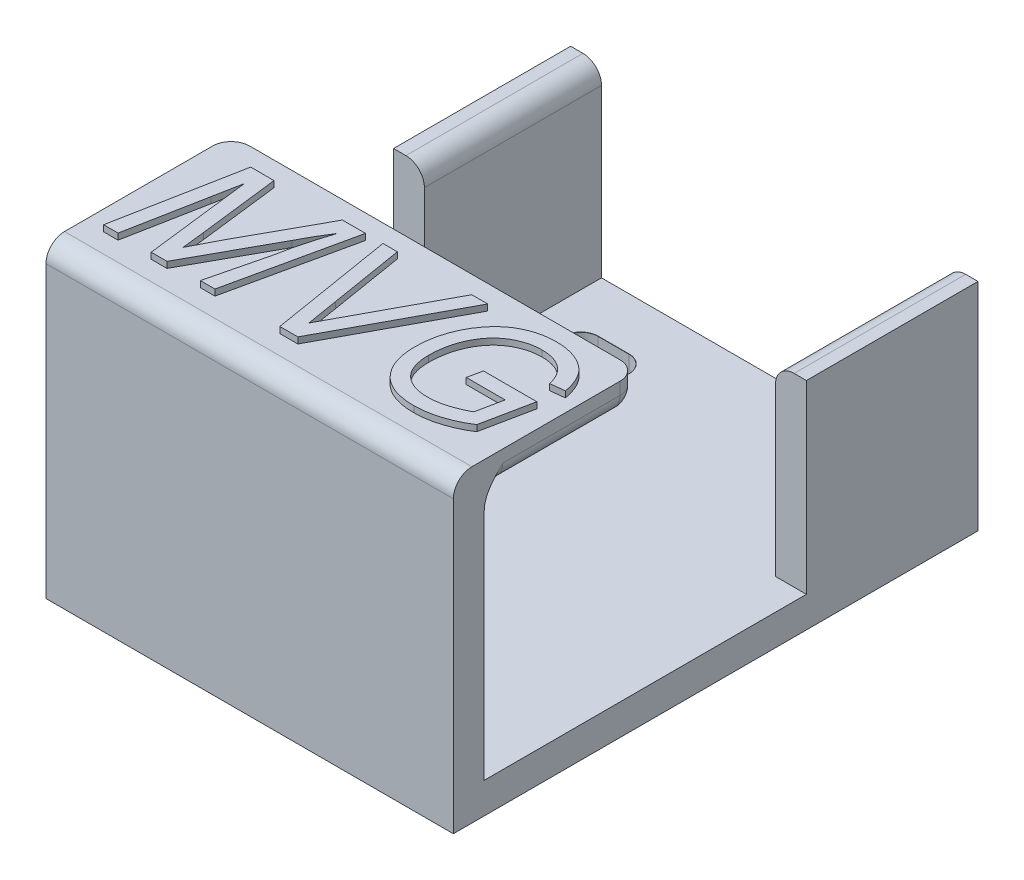
from build123d import *

# Parameters (mm, degrees)
SKETCH_1_W            = 66
SKETCH_1_H            = 85
EXTRUDE_297_DEPTH     = 5
SKETCH_2_W            = 66
SKETCH_2_H            = 5
EXTRUDE_2_DEPTH       = 45
SKETCH_3_W            = 66
SKETCH_3_H            = 5
EXTRUDE_3_DEPTH       = 25
SKETCH_4_W            = 5
SKETCH_4_H            = 28.694306297
SKETCH_4_H_2          = 27.803616381
EXTRUDE_4_DEPTH       = 30
HOLE_START            = -1
HOLE_WIZARD_M51_DEPTH = 7
FILLET_1_R            = 3
FILLET_2_R            = 3
FILLET_6_R            = 3
FILLET_9_R            = 3
FILLET_10_R           = 3
FILLET_11_R           = 3
FILLET_12_R           = 3
EXTRUDE_2578_DEPTH    = 1


with BuildPart() as part:
    # Эскиз1 → Extrude 297 (new body)
    with BuildSketch(Plane(origin=(0, 0, 0), x_dir=(1, 0, 0), z_dir=(0, 1, 0))):
        with Locations((33, 42.5)):
            Rectangle(SKETCH_1_W, SKETCH_1_H)
    extrude(amount=EXTRUDE_297_DEPTH)

    # Эскиз2 → Бобышка-Вытянуть2 (add)
    with BuildSketch(Plane(origin=(0, 5, 0), x_dir=(1, 0, 0), z_dir=(0, 1, 0))):
        with Locations((33, 2.5)):
            Rectangle(SKETCH_2_W, SKETCH_2_H)
    extrude(amount=EXTRUDE_2_DEPTH)

    # Эскиз3 → Бобышка-Вытянуть3 (add)
    with BuildSketch(Plane(origin=(0, 0, -5), x_dir=(-1, 0, 0), z_dir=(0, 0, -1))):
        with Locations((-33, 47.5)):
            Rectangle(SKETCH_3_W, SKETCH_3_H)
    extrude(amount=EXTRUDE_3_DEPTH)

    # Эскиз4 → Бобышка-Вытянуть4 (add)
    with BuildSketch(Plane(origin=(0, 5, 0), x_dir=(1, 0, 0), z_dir=(0, 1, 0))):
        with Locations((2.5, 70.652846852)):
            Rectangle(SKETCH_4_W, SKETCH_4_H)
        with Locations((63.5, 71.09819181)):
            Rectangle(SKETCH_4_W, SKETCH_4_H_2)
    extrude(amount=EXTRUDE_4_DEPTH)

    # Прорезь с зазором M51: read off the stored shape, not the designer's step
    # Прорезь с зазором M51 outline → Прорезь с зазором M51 (cut)
    with BuildSketch(Plane(origin=(0, 0, 0), x_dir=(1, 0, 0), z_dir=(0, 1, 0)).offset(HOLE_START)):
        with BuildLine():
            Line((49.872505679, 71.03548331), (54.872505679, 71.03548331))
            ThreePointArc((54.872505679, 71.03548331), (57.622505679, 73.78548331), (54.872505679, 76.53548331))
            Line((54.872505679, 76.53548331), (49.872505679, 76.53548331))
            ThreePointArc((49.872505679, 76.53548331), (47.122505679, 73.78548331), (49.872505679, 71.03548331))
        make_face()
        with BuildLine():
            ThreePointArc((17.908874153, 71.03548331), (20.658874153, 73.78548331), (17.908874153, 76.53548331))
            Line((17.908874153, 76.53548331), (12.908874153, 76.53548331))
            ThreePointArc((12.908874153, 76.53548331), (10.158874153, 73.78548331), (12.908874153, 71.03548331))
            Line((12.908874153, 71.03548331), (17.908874153, 71.03548331))
        make_face()
    extrude(amount=HOLE_WIZARD_M51_DEPTH, mode=Mode.SUBTRACT)

    # Hole Wizard M51 2: loft between two sections, ruled curve by curve
    hole_wizard_m51_2_from = [
        Edge.make_three_point_arc((54.872505679, 4.975, -71.03548331), (56.817049328, 4.975, -71.840939662), (57.622505679, 4.975, -73.78548331)),
        Edge.make_three_point_arc((57.622505679, 4.975, -73.78548331), (56.817049328, 4.975, -75.730026958), (54.872505679, 4.975, -76.53548331)),
        Edge.make_three_point_arc((49.872505679, 4.975, -76.53548331), (47.927962031, 4.975, -75.730026958), (47.122505679, 4.975, -73.78548331)),
        Edge.make_three_point_arc((47.122505679, 4.975, -73.78548331), (47.927962031, 4.975, -71.840939662), (49.872505679, 4.975, -71.03548331)),
        Edge.make_line((54.872505679, 4.975, -76.53548331), (49.872505679, 4.975, -76.53548331)),
        Edge.make_line((54.872505679, 4.975, -71.03548331), (49.872505679, 4.975, -71.03548331)),
    ]
    hole_wizard_m51_2_to = [
        Edge.make_three_point_arc((54.872505679, 5, -71.01048331), (56.834726997, 5, -71.823261992), (57.647505679, 5, -73.78548331)),
        Edge.make_three_point_arc((57.647505679, 5, -73.78548331), (56.834726997, 5, -75.747704628), (54.872505679, 5, -76.56048331)),
        Edge.make_three_point_arc((49.872505679, 5, -76.56048331), (47.910284362, 5, -75.747704628), (47.097505679, 5, -73.78548331)),
        Edge.make_three_point_arc((47.097505679, 5, -73.78548331), (47.910284362, 5, -71.823261992), (49.872505679, 5, -71.01048331)),
        Edge.make_line((54.872505679, 5, -76.56048331), (49.872505679, 5, -76.56048331)),
        Edge.make_line((54.872505679, 5, -71.01048331), (49.872505679, 5, -71.01048331)),
    ]
    hole_wizard_m51_2 = Solid(Shell([*[Face.make_surface_from_curves(hole_wizard_m51_2_from[k], hole_wizard_m51_2_to[k]) for k in range(6)], Face(Wire(hole_wizard_m51_2_from)), Face(Wire(hole_wizard_m51_2_to))]))
    add(hole_wizard_m51_2, mode=Mode.SUBTRACT)

    # Hole Wizard M51 3: loft between two sections, ruled curve by curve
    hole_wizard_m51_3_from = [
        Edge.make_three_point_arc((17.908874153, 4.975, -71.03548331), (19.853417801, 4.975, -71.840939662), (20.658874153, 4.975, -73.78548331)),
        Edge.make_three_point_arc((20.658874153, 4.975, -73.78548331), (19.853417801, 4.975, -75.730026958), (17.908874153, 4.975, -76.53548331)),
        Edge.make_three_point_arc((12.908874153, 4.975, -76.53548331), (10.964330505, 4.975, -75.730026958), (10.158874153, 4.975, -73.78548331)),
        Edge.make_three_point_arc((10.158874153, 4.975, -73.78548331), (10.964330505, 4.975, -71.840939662), (12.908874153, 4.975, -71.03548331)),
        Edge.make_line((17.908874153, 4.975, -76.53548331), (12.908874153, 4.975, -76.53548331)),
        Edge.make_line((17.908874153, 4.975, -71.03548331), (12.908874153, 4.975, -71.03548331)),
    ]
    hole_wizard_m51_3_to = [
        Edge.make_three_point_arc((17.908874153, 5, -71.01048331), (19.871095471, 5, -71.823261992), (20.683874153, 5, -73.78548331)),
        Edge.make_three_point_arc((20.683874153, 5, -73.78548331), (19.871095471, 5, -75.747704628), (17.908874153, 5, -76.56048331)),
        Edge.make_three_point_arc((12.908874153, 5, -76.56048331), (10.946652835, 5, -75.747704628), (10.133874153, 5, -73.78548331)),
        Edge.make_three_point_arc((10.133874153, 5, -73.78548331), (10.946652835, 5, -71.823261992), (12.908874153, 5, -71.01048331)),
        Edge.make_line((17.908874153, 5, -76.56048331), (12.908874153, 5, -76.56048331)),
        Edge.make_line((17.908874153, 5, -71.01048331), (12.908874153, 5, -71.01048331)),
    ]
    hole_wizard_m51_3 = Solid(Shell([*[Face.make_surface_from_curves(hole_wizard_m51_3_from[k], hole_wizard_m51_3_to[k]) for k in range(6)], Face(Wire(hole_wizard_m51_3_from)), Face(Wire(hole_wizard_m51_3_to))]))
    add(hole_wizard_m51_3, mode=Mode.SUBTRACT)

    # Скругление1
    fillet_1_edges = [part.edges().sort_by_distance(p)[0] for p in [
        (33, 45, -30),
    ]]
    fillet(fillet_1_edges, radius=FILLET_1_R)

    # Скругление2
    fillet_2_edges = [part.edges().sort_by_distance(p)[0] for p in [
        (5, 35, -70.652846851),
    ]]
    fillet(fillet_2_edges, radius=FILLET_2_R)

    # Скругление6
    fillet_6_edges = [part.edges().sort_by_distance(p)[0] for p in [
        (61, 35, -71.098191809),
    ]]
    fillet(fillet_6_edges, radius=FILLET_6_R)

    # Скругление9
    fillet_9_edges = [part.edges().sort_by_distance(p)[0] for p in [
        (0, 49, -30),
        (0, 45, -16),
        (0, 45.878679656, -29.121320344),
    ]]
    fillet(fillet_9_edges, radius=FILLET_9_R)

    # Скругление10
    fillet_10_edges = [part.edges().sort_by_distance(p)[0] for p in [
        (66, 45, -16),
        (66, 45.878679656, -29.121320344),
        (66, 49, -30),
    ]]
    fillet(fillet_10_edges, radius=FILLET_10_R)

    # Скругление11
    fillet_11_edges = [part.edges().sort_by_distance(p)[0] for p in [
        (33, 50, 0),
    ]]
    fillet(fillet_11_edges, radius=FILLET_11_R)

    # Скругление12
    # the kernel refuses this fillet: 3 mm, written as the material it adds along each edge
    with BuildSketch(Plane(origin=(3, 48, -5), x_dir=(0.8017442392976515, 0.5976672776328231, 0), z_dir=(0.5976672776328231, -0.8017442392976515, 0))) as fillet_12_piece_1_section:
        with BuildLine():
            CenterArc((3 + FILLET_12_R, -FILLET_12_R), FILLET_12_R, 90, 90)
            Line((3, -FILLET_12_R), (3, 0))
            Line((3, 0), (3 + FILLET_12_R, 0))
        make_face()
    fillet_12_piece_1 = revolve(axis=Axis((3, 48, -5), (0, 0, 1)), revolution_arc=233.296989237, mode=Mode.PRIVATE)
    fillet_12_piece_1 = split(fillet_12_piece_1, bisect_by=Plane(origin=(3, 50, -5), z_dir=(0, -1, 0)), keep=Keep.TOP, mode=Mode.PRIVATE)
    fillet_12_piece_1 = split(fillet_12_piece_1, bisect_by=Plane(origin=(0, 48, -5), z_dir=(1, 0, 0)), keep=Keep.TOP, mode=Mode.PRIVATE)
    add(fillet_12_piece_1)
    with BuildSketch(Plane(origin=(3, 45, -5), x_dir=(0, -1, 0), z_dir=(1, 0, 0))) as fillet_12_piece_2:
        with BuildLine():
            CenterArc((FILLET_12_R, FILLET_12_R), FILLET_12_R, 180, 90)
            Line((0, FILLET_12_R), (0, 0))
            Line((0, 0), (FILLET_12_R, 0))
        make_face()
    extrude(amount=60)
    with BuildSketch(Plane(origin=(63, 48, -5), x_dir=(-0.8017442392976499, 0.5976672776328252, 0), z_dir=(-0.5976672776328252, -0.8017442392976499, 0))) as fillet_12_piece_3_section:
        with BuildLine():
            CenterArc((3 + FILLET_12_R, FILLET_12_R), FILLET_12_R, 180, 90)
            Line((3 + FILLET_12_R, 0), (3, 0))
            Line((3, 0), (3, FILLET_12_R))
        make_face()
    fillet_12_piece_3 = revolve(axis=Axis((63, 48, -5), (0, 0, -1)), revolution_arc=233.296989237, mode=Mode.PRIVATE)
    fillet_12_piece_3 = split(fillet_12_piece_3, bisect_by=Plane(origin=(63, 50, -5), z_dir=(0, -1, 0)), keep=Keep.TOP, mode=Mode.PRIVATE)
    fillet_12_piece_3 = split(fillet_12_piece_3, bisect_by=Plane(origin=(66, 48, -5), z_dir=(-1, 0, 0)), keep=Keep.TOP, mode=Mode.PRIVATE)
    add(fillet_12_piece_3)

    # Эскиз9 → Extrude 2578 (add)
    with BuildSketch(Plane(origin=(0, 50, 0), x_dir=(1, 0, 0), z_dir=(0, 1, 0))):
        with BuildLine():
            Line((3.210191627, 6.123493175), (7.040319832, 26.123493175))
            Line((7.040319832, 26.123493175), (10.818364704, 26.123493175))
            Line((10.818364704, 26.123493175), (12.396890345, 13.142723944))
            add(Edge.make_bspline(
                [(12.396890345, 13.142723944), (12.422362068, 12.919711675), (12.471163265, 12.492443146), (12.539607466, 11.879495223), (12.598761191, 11.322356769), (12.654274019, 10.822815868), (12.70749324, 10.381062786), (12.752028253, 9.996495563), (12.786416452, 9.668964071), (12.810661259, 9.470155523), (12.821569832, 9.380704713)],
                knots=[0, 0, 0, 0, 1.422923083, 2.72617402, 3.909763634, 4.97461542, 5.912343199, 6.730385719, 7.428756826, 8, 8, 8, 8], degree=3))
            add(Edge.make_bspline(
                [(12.821569832, 9.380704713), (12.861788457, 9.45540912), (12.959208018, 9.636361864), (13.124931848, 9.955551346), (13.343652092, 10.365621262), (13.608141319, 10.869717975), (13.913597971, 11.470267767), (14.272854231, 12.160655513), (14.676530691, 12.944393012), (14.959837585, 13.499202176), (15.109230088, 13.791762405)],
                knots=[0, 0, 0, 0, 0.409776244, 0.992580477, 1.737009525, 2.654476852, 3.742033759, 4.991187186, 6.413402259, 8, 8, 8, 8], degree=3))
            Line((15.109230088, 13.791762405), (21.900095473, 26.123493175))
            Line((21.900095473, 26.123493175), (25.634069832, 26.123493175))
            Line((25.634069832, 26.123493175), (21.251057011, 6.123493175))
            Line((21.251057011, 6.123493175), (18.88326855, 6.123493175))
            Line((18.88326855, 6.123493175), (21.23102496, 15.686794457))
            add(Edge.make_bspline(
                [(21.23102496, 15.686794457), (21.281574613, 15.975545053), (21.385511701, 16.56925627), (21.575419188, 17.477392628), (21.796873787, 18.429546835), (22.049842892, 19.424155841), (22.329393528, 20.462586436), (22.64412663, 21.542501929), (22.987602065, 22.665669267), (23.233230635, 23.427494532), (23.358428806, 23.815800867)],
                knots=[0, 0, 0, 0, 0.836484954, 1.719928915, 2.647136768, 3.625976296, 4.64843834, 5.715822837, 6.835742914, 8, 8, 8, 8], degree=3))
            add(Edge.make_bspline(
                [(23.358428806, 23.815800867), (23.105153522, 23.423220757), (22.607014454, 22.651098476), (21.908810804, 21.486493461), (21.26660216, 20.339134912), (20.874734766, 19.570270986), (20.682146755, 19.192403431)],
                knots=[0, 0, 0, 0, 1.048797977, 2.062764432, 3.047921947, 4, 4, 4, 4], degree=3))
            Line((20.682146755, 19.192403431), (13.482627524, 6.123493175))
            Line((13.482627524, 6.123493175), (10.926537781, 6.123493175))
            Line((10.926537781, 6.123493175), (9.372050601, 18.887916251))
            add(Edge.make_bspline(
                [(9.372050601, 18.887916251), (9.334520648, 19.199064449), (9.254957624, 19.858694664), (9.131607871, 20.905964196), (8.991298437, 22.066480547), (8.891435048, 22.878319713), (8.839198037, 23.302980354)],
                knots=[0, 0, 0, 0, 0.845682193, 1.792835479, 2.845466023, 4, 4, 4, 4], degree=3))
            add(Edge.make_bspline(
                [(8.839198037, 23.302980354), (8.792604309, 23.059896649), (8.702227471, 22.588392482), (8.568502769, 21.903838195), (8.450239951, 21.264865701), (8.337834288, 20.671694201), (8.229371137, 20.127401255), (8.131661137, 19.628223209), (8.049989325, 19.174522357), (7.992907926, 18.887840394), (7.965800601, 18.751698303)],
                knots=[0, 0, 0, 0, 1.281779497, 2.486239759, 3.612086327, 4.647019747, 5.612739922, 6.486241797, 7.281132981, 8, 8, 8, 8], degree=3))
            Line((7.965800601, 18.751698303), (5.549935217, 6.123493175))
            Line((5.549935217, 6.123493175), (3.210191627, 6.123493175))
        make_face()
        with BuildLine():
            Line((31.759871114, 6.123493175), (28.470608293, 26.123493175))
            Line((28.470608293, 26.123493175), (30.806345473, 26.123493175))
            Line((30.806345473, 26.123493175), (32.777499319, 14.124294457))
            add(Edge.make_bspline(
                [(32.777499319, 14.124294457), (32.81999756, 13.861167967), (32.9028583, 13.34813836), (33.02763968, 12.600590466), (33.144449112, 11.894228379), (33.25122474, 11.228715011), (33.356575904, 10.604130895), (33.4529385, 10.019227053), (33.539424666, 9.475199506), (33.598534312, 9.126919431), (33.626858293, 8.960031636)],
                knots=[0, 0, 0, 0, 1.222255508, 2.383086792, 3.475457659, 4.505413456, 5.473947086, 6.380061867, 7.223762935, 8, 8, 8, 8], degree=3))
            add(Edge.make_bspline(
                [(33.626858293, 8.960031636), (33.73495292, 9.161729768), (33.945502324, 9.554602412), (34.254170468, 10.127426143), (34.546053158, 10.668608285), (34.824589138, 11.176909698), (35.079142149, 11.658060265), (35.319722322, 12.106674232), (35.545069045, 12.524145703), (35.688895422, 12.792792463), (35.75826855, 12.92237138)],
                knots=[0, 0, 0, 0, 1.220672504, 2.3776563, 3.470954619, 4.500571287, 5.4693961, 6.374528101, 7.215970862, 8, 8, 8, 8], degree=3))
            Line((35.75826855, 12.92237138), (42.857627524, 26.123493175))
            Line((42.857627524, 26.123493175), (45.437755729, 26.123493175))
            Line((45.437755729, 26.123493175), (34.684550601, 6.123493175))
            Line((34.684550601, 6.123493175), (31.759871114, 6.123493175))
        make_face()
        with BuildLine():
            Line((54.007467268, 14.072211123), (54.496249319, 16.379903431))
            Line((54.496249319, 16.379903431), (63.142082652, 16.379903431))
            Line((63.142082652, 16.379903431), (61.487435217, 8.306986764))
            add(Edge.make_bspline(
                [(61.487435217, 8.306986764), (61.210748259, 8.131895567), (60.650279237, 7.777223294), (59.751092563, 7.3148254), (58.798336172, 6.898713988), (57.80059043, 6.537013389), (56.779049702, 6.239889369), (55.752890242, 6.028693168), (54.733548905, 5.893578776), (54.055950841, 5.875882593), (53.719005729, 5.867082918)],
                knots=[0, 0, 0, 0, 0.952100779, 1.928616355, 2.937626071, 3.97482514, 5.013790607, 6.029397299, 7.020090253, 8, 8, 8, 8], degree=3))
            add(Edge.make_bspline(
                [(53.719005729, 5.867082918), (53.372700616, 5.873816195), (52.701744908, 5.886861715), (51.729418866, 6.01472358), (50.824238094, 6.216273784), (49.984050505, 6.499790435), (49.213088632, 6.870230876), (48.511219416, 7.322585103), (47.871196829, 7.852278245), (47.510248352, 8.26950267), (47.32878137, 8.479262405)],
                knots=[0, 0, 0, 0, 1.162231544, 2.251788547, 3.286290562, 4.271810624, 5.222437566, 6.150319582, 7.070072483, 8, 8, 8, 8], degree=3))
            add(Edge.make_bspline(
                [(47.32878137, 8.479262405), (47.18560416, 8.665985949), (46.898032499, 9.04102049), (46.542783289, 9.659484538), (46.228918911, 10.309267632), (45.983751482, 11.003853673), (45.784696768, 11.732999307), (45.652220889, 12.504560531), (45.564921557, 13.312985476), (45.554994791, 13.866309235), (45.549935217, 14.148332918)],
                knots=[0, 0, 0, 0, 0.931025344, 1.869965919, 2.818748224, 3.78585849, 4.78284169, 5.809032914, 6.883285607, 8, 8, 8, 8], degree=3))
            add(Edge.make_bspline(
                [(45.549935217, 14.148332918), (45.554603181, 14.442270092), (45.563868413, 15.025692811), (45.636379464, 15.890278061), (45.761596047, 16.73555016), (45.934169574, 17.559270063), (46.149167095, 18.364661566), (46.419221036, 19.148735931), (46.740052316, 19.911763634), (47.103225136, 20.65202987), (47.505951651, 21.355518782), (47.93450684, 22.018177299), (48.387191996, 22.634253201), (48.869046632, 23.199377382), (49.374454521, 23.719555968), (49.908514991, 24.188500172), (50.46646794, 24.611049626), (51.0499981, 24.984630633), (51.654749931, 25.312078782), (52.27688305, 25.597983218), (52.91631683, 25.83738974), (53.569383034, 26.040333189), (54.2421438, 26.192275518), (54.930417332, 26.297610785), (55.635160333, 26.371066472), (56.110640862, 26.376934444), (56.351217268, 26.379903431)],
                knots=[0, 0, 0, 0, 1.160897272, 2.304212957, 3.423934589, 4.53397293, 5.626719052, 6.714335181, 7.806635619, 8.894149414, 9.969105247, 11.006440655, 12.009743243, 12.986387491, 13.937572267, 14.87194958, 15.79083293, 16.69948517, 17.605853263, 18.505148493, 19.401577227, 20.300918866, 21.204335112, 22.122718703, 23.050161765, 24, 24, 24, 24], degree=3))
            add(Edge.make_bspline(
                [(56.351217268, 26.379903431), (56.691003516, 26.371255948), (57.35639927, 26.354321777), (58.326720493, 26.204350812), (59.246865619, 25.973039093), (59.966491745, 25.687484368), (60.508021924, 25.420593722), (60.887791608, 25.202939261), (61.247688481, 24.977304857), (61.576076916, 24.724815287), (61.885835319, 24.46350204), (62.166511317, 24.179167708), (62.428600563, 23.885105921), (62.742467415, 23.458505664), (63.094348029, 22.869705001), (63.440311759, 22.075615467), (63.730860742, 21.187679247), (63.862800249, 20.554833405), (63.931345473, 20.226057277)],
                knots=[0, 0, 0, 0, 1.513250879, 2.963365096, 4.364895725, 5.733014485, 6.403689369, 7.053988889, 7.68294403, 8.294715877, 8.898240833, 9.487364028, 10.073503997, 10.65195027, 11.845026783, 13.121175183, 14.504392675, 16, 16, 16, 16], degree=3))
            Line((63.931345473, 20.226057277), (61.623653165, 19.969647021))
            add(Edge.make_bspline(
                [(61.623653165, 19.969647021), (61.584332055, 20.130446011), (61.506886842, 20.447148968), (61.357525757, 20.903298743), (61.168052934, 21.326086655), (60.963861937, 21.725472567), (60.719181254, 22.092464069), (60.449817346, 22.431733905), (60.147804079, 22.740138675), (59.820760549, 23.021171549), (59.463200647, 23.26747932), (59.084840974, 23.488060925), (58.677761559, 23.666406651), (58.247718548, 23.815311694), (57.793291435, 23.930863478), (57.315426169, 24.015555067), (56.812934415, 24.063208187), (56.470172351, 24.069167677), (56.295127524, 24.072211123)],
                knots=[0, 0, 0, 0, 1.079432158, 2.126004382, 3.124393446, 4.098322801, 5.047641653, 5.995681208, 6.919529094, 7.858524372, 8.803197526, 9.747348617, 10.710351979, 11.696394722, 12.712443763, 13.764870275, 14.858543763, 16, 16, 16, 16], degree=3))
            add(Edge.make_bspline(
                [(56.295127524, 24.072211123), (56.110656138, 24.069938748), (55.743502881, 24.065416042), (55.198037709, 24.004153464), (54.658886668, 23.91988939), (54.131430739, 23.788400554), (53.610410235, 23.630344688), (53.102713148, 23.426391538), (52.599560231, 23.196535699), (52.111768062, 22.922821379), (51.640334989, 22.615406362), (51.18805485, 22.274087027), (50.763779792, 21.892995129), (50.364638839, 21.472522831), (49.990370177, 21.016024371), (49.633883883, 20.52643782), (49.312245548, 19.993892143), (49.007458761, 19.432841457), (48.736228446, 18.842927069), (48.503616741, 18.229011501), (48.30316117, 17.596665586), (48.138011465, 16.944101751), (48.015923337, 16.270359659), (47.921836043, 15.579514076), (47.870965756, 14.866241179), (47.862119333, 14.3847827), (47.857627524, 14.140320098)],
                knots=[0, 0, 0, 0, 0.910182469, 1.811535459, 2.706791946, 3.60224261, 4.492655297, 5.392488035, 6.300973671, 7.221790804, 8.150714602, 9.077671133, 10.016091568, 10.962720455, 11.936843414, 12.928565769, 13.949591953, 15.005606631, 16.079396427, 17.151971207, 18.244540305, 19.352633389, 20.472432006, 21.623014359, 22.793075369, 24, 24, 24, 24], degree=3))
            add(Edge.make_bspline(
                [(47.857627524, 14.140320098), (47.862005425, 13.90241494), (47.870536568, 13.438813134), (47.943335976, 12.76619013), (48.061427501, 12.138302576), (48.230928406, 11.556135071), (48.44532118, 11.017667388), (48.711807167, 10.52439003), (49.026020411, 10.076239176), (49.387756033, 9.673785779), (49.79436757, 9.320865566), (50.238789635, 9.015026446), (50.717375978, 8.752846339), (51.233516368, 8.540529251), (51.786466262, 8.375233202), (52.375938127, 8.262781927), (53.001243278, 8.187092817), (53.430307518, 8.178957652), (53.650896755, 8.174775226)],
                knots=[0, 0, 0, 0, 1.204869754, 2.347909566, 3.422600963, 4.43736431, 5.414726527, 6.353100702, 7.270886692, 8.18103633, 9.087280539, 9.991780778, 10.909092918, 11.846320248, 12.813751626, 13.827386831, 14.883022553, 16, 16, 16, 16], degree=3))
            add(Edge.make_bspline(
                [(53.650896755, 8.174775226), (53.878106512, 8.180988956), (54.337728954, 8.193558707), (55.034426749, 8.271315174), (55.743426111, 8.405150541), (56.464657488, 8.589952564), (57.19821668, 8.827531863), (57.941808818, 9.124203975), (58.705046939, 9.459984518), (59.205380664, 9.725998042), (59.460191627, 9.861473944)],
                knots=[0, 0, 0, 0, 0.892369829, 1.805174244, 2.749498628, 3.723900984, 4.727356907, 5.775331026, 6.867016121, 8, 8, 8, 8], degree=3))
            Line((59.460191627, 9.861473944), (60.321569832, 14.072211123))
            Line((60.321569832, 14.072211123), (54.007467268, 14.072211123))
        make_face()
    extrude(amount=EXTRUDE_2578_DEPTH)


solid = part.part
